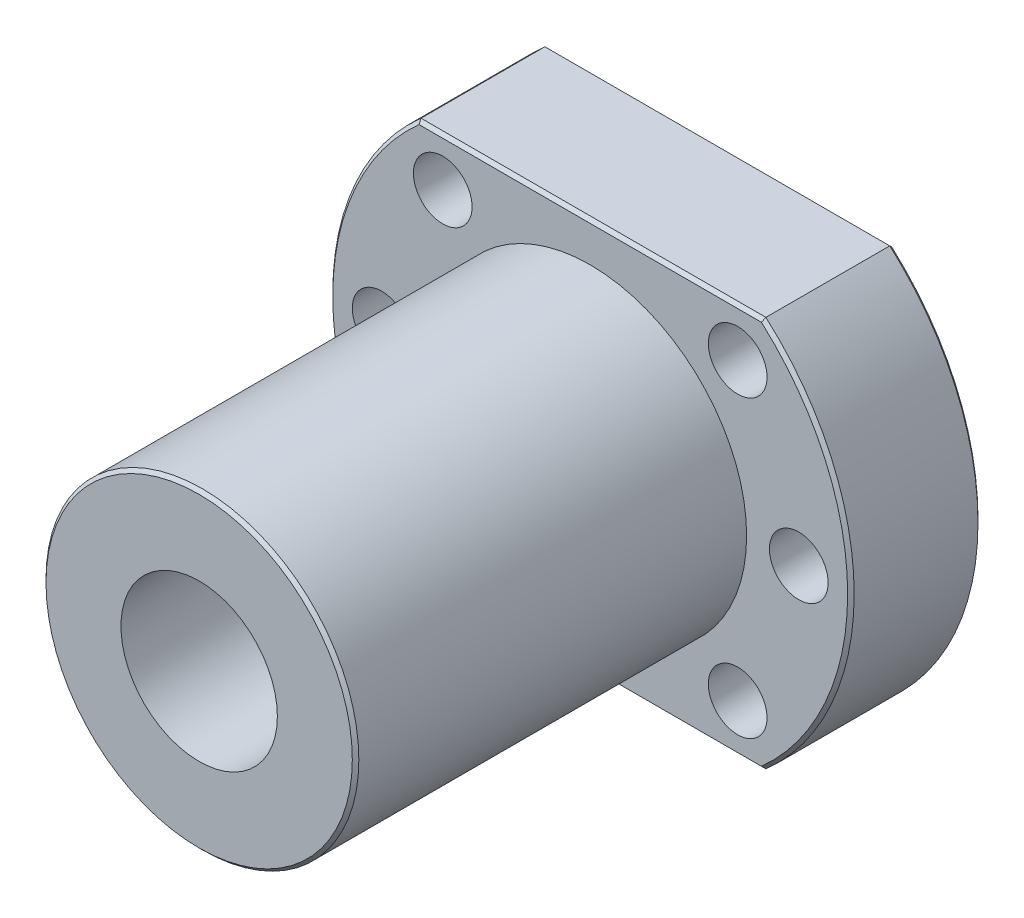
from build123d import *

# Parameters (mm, degrees)
SKETCH1_R           = 2.25
BOSS_EXTRUDE1_DEPTH = 10
SKETCH2_R           = 12
BOSS_EXTRUDE2_DEPTH = 30
SKETCH3_R           = 6
CUT_EXTRUDE1_DEPTH  = 48.16990566
CHAMFER1_SIZE       = 0.25
SKETCH4_R           = 3.5
CUT_EXTRUDE2_DEPTH  = 5


with BuildPart() as part:
    # Sketch1 → Boss-Extrude1 (new body)
    with BuildSketch(Plane.XY):
        with BuildLine():
            Line((-13.228756555, 15), (13.228756555, 15))
            ThreePointArc((13.228756555, 15), (20, 0), (13.228756555, -15))
            Line((13.228756555, -15), (-13.228756555, -15))
            ThreePointArc((-13.228756555, -15), (-20, 0), (-13.228756555, 15))
        make_face()
        with Locations((-16, 0)):
            Circle(SKETCH1_R, mode=Mode.SUBTRACT)
        with Locations((-11.313708499, 11.313708499)):
            Circle(SKETCH1_R, mode=Mode.SUBTRACT)
        with Locations((11.313708499, 11.313708499)):
            Circle(SKETCH1_R, mode=Mode.SUBTRACT)
        with Locations((16, 0)):
            Circle(SKETCH1_R, mode=Mode.SUBTRACT)
        with Locations((11.313708499, -11.313708499)):
            Circle(SKETCH1_R, mode=Mode.SUBTRACT)
        with Locations((-11.313708499, -11.313708499)):
            Circle(SKETCH1_R, mode=Mode.SUBTRACT)
    extrude(amount=BOSS_EXTRUDE1_DEPTH)

    # Sketch2 → Boss-Extrude2 (add)
    with BuildSketch(Plane.XY.offset(10)):
        Circle(SKETCH2_R)
    extrude(amount=BOSS_EXTRUDE2_DEPTH)

    # Sketch3 → Cut-Extrude1 (cut, through all)
    with BuildSketch(Plane.XY.offset(40)):
        Circle(SKETCH3_R)
    extrude(amount=-CUT_EXTRUDE1_DEPTH, mode=Mode.SUBTRACT)

    # Chamfer1
    chamfer1_edges = [part.edges().sort_by_distance(p)[0] for p in [
        (0, -15, 0),
        (-20, 0, 0),
        (20, 0, 0),
        (0, 15, 0),
        (-20, 0, 10),
        (0, -15, 10),
        (20, 0, 10),
        (0, 15, 10),
        (-12, 0, 40),
    ]]
    chamfer(chamfer1_edges, length=CHAMFER1_SIZE)

    # Sketch4 → Cut-Extrude2 (cut)
    with BuildSketch(Plane(origin=(0, 0, 0), x_dir=(-1, 0, 0), z_dir=(0, 0, -1))):
        with Locations((-11.313708499, 11.313708499)):
            Circle(SKETCH4_R)
        with Locations((11.313708499, 11.313708499)):
            Circle(SKETCH4_R)
        with Locations((16, 0)):
            Circle(SKETCH4_R)
        with Locations((11.313708499, -11.313708499)):
            Circle(SKETCH4_R)
        with Locations((-11.313708499, -11.313708499)):
            Circle(SKETCH4_R)
        with Locations((-16, 0)):
            Circle(SKETCH4_R)
    extrude(amount=-CUT_EXTRUDE2_DEPTH, mode=Mode.SUBTRACT)


solid = part.part
